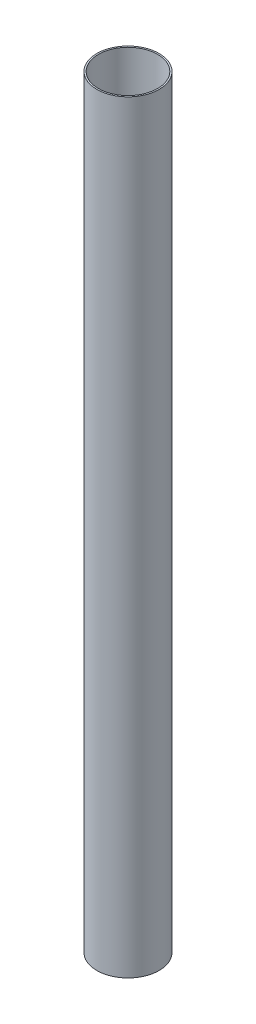
from build123d import *

# Parameters (mm, degrees)
SKETCH1_R   = 25.4
SKETCH1_R_2 = 24.1554
BODY_DEPTH  = 622.3


with BuildPart() as part:
    # Sketch1 → body (new body)
    with BuildSketch(Plane(origin=(0, 0, 0), x_dir=(1, 0, 0), z_dir=(0, 1, 0))):
        Circle(SKETCH1_R)
        Circle(SKETCH1_R_2, mode=Mode.SUBTRACT)
    extrude(amount=BODY_DEPTH)


solid = part.part
